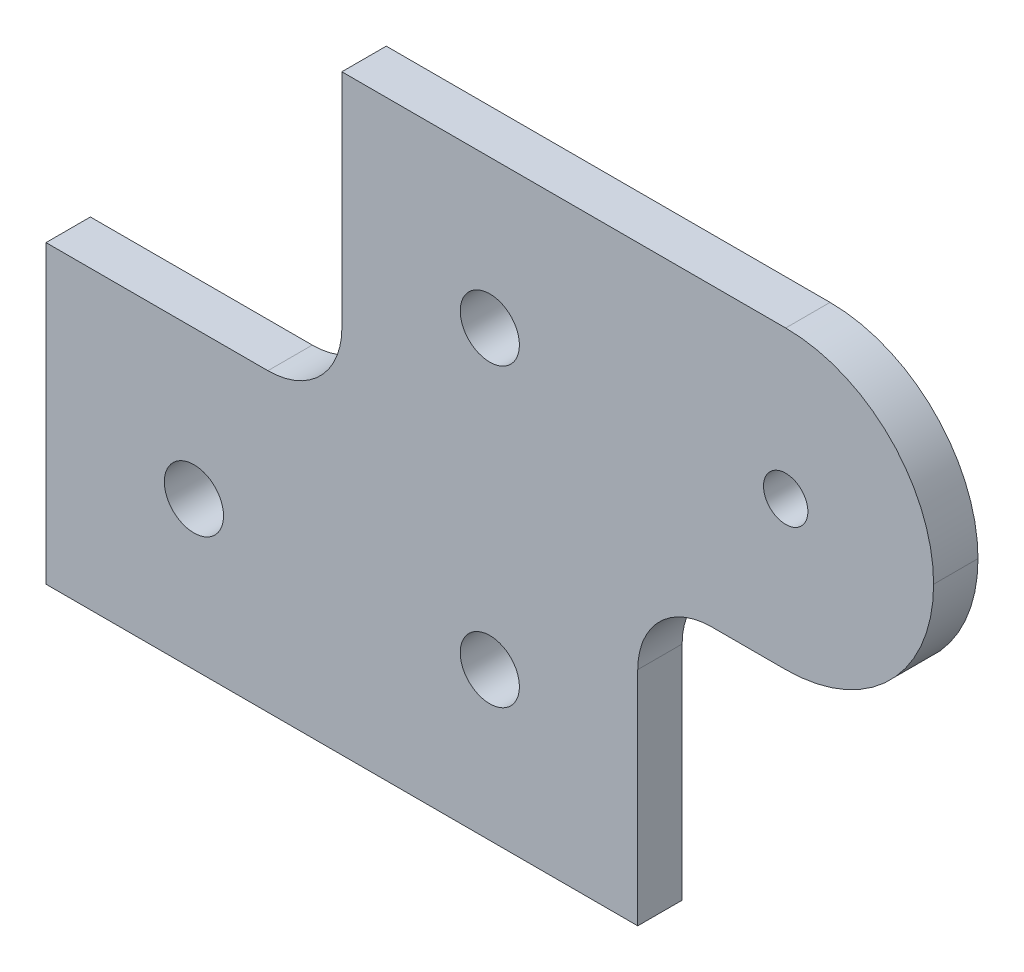
from build123d import *

# Parameters (mm, degrees)
ESBO_O1_W                = 20
ESBO_O1_H                = 20
ESBO_O1_R                = 2
ESBO_O1_R_2              = 1.5
RESSALTO_EXTRUS_O1_DEPTH = 3
FILETE1_R                = 10
FILETE2_R                = 5


with BuildPart() as part:
    # Esboço1 → Ressalto-extrusão1 (new body)
    # profile 1 of 4: a face of its own
    with BuildSketch(Plane.XY):
        with Locations((10, 10)):
            Rectangle(ESBO_O1_W, ESBO_O1_H)
        with Locations((10, 10)):
            Circle(ESBO_O1_R, mode=Mode.SUBTRACT)
    # profile 2 of 4: a face of its own
    with BuildSketch(Plane.XY):
        with Locations((30, 10)):
            Rectangle(ESBO_O1_W, ESBO_O1_H)
        with Locations((30, 10)):
            Circle(ESBO_O1_R, mode=Mode.SUBTRACT)
    # profile 3 of 4: a face of its own
    with BuildSketch(Plane.XY):
        with Locations((30, 30)):
            Rectangle(ESBO_O1_W, ESBO_O1_H)
        with Locations((30, 30)):
            Circle(ESBO_O1_R, mode=Mode.SUBTRACT)
    # profile 4 of 4: a face of its own
    with BuildSketch(Plane.XY):
        with Locations((50, 30)):
            Rectangle(ESBO_O1_W, ESBO_O1_H)
        with Locations((50, 30)):
            Circle(ESBO_O1_R_2, mode=Mode.SUBTRACT)
    extrude(amount=RESSALTO_EXTRUS_O1_DEPTH)

    # Filete1
    filete1_edges = [part.edges().sort_by_distance(p)[0] for p in [
        (60, 20, 1.5),
        (60, 40, 1.5),
    ]]
    fillet(filete1_edges, radius=FILETE1_R - 0.0001)  # a hair under: the kernel refuses the full size

    # Filete2
    filete2_edges = [part.edges().sort_by_distance(p)[0] for p in [
        (20, 20, 1.5),
        (40, 20, 1.5),
    ]]
    fillet(filete2_edges, radius=FILETE2_R)


solid = part.part
